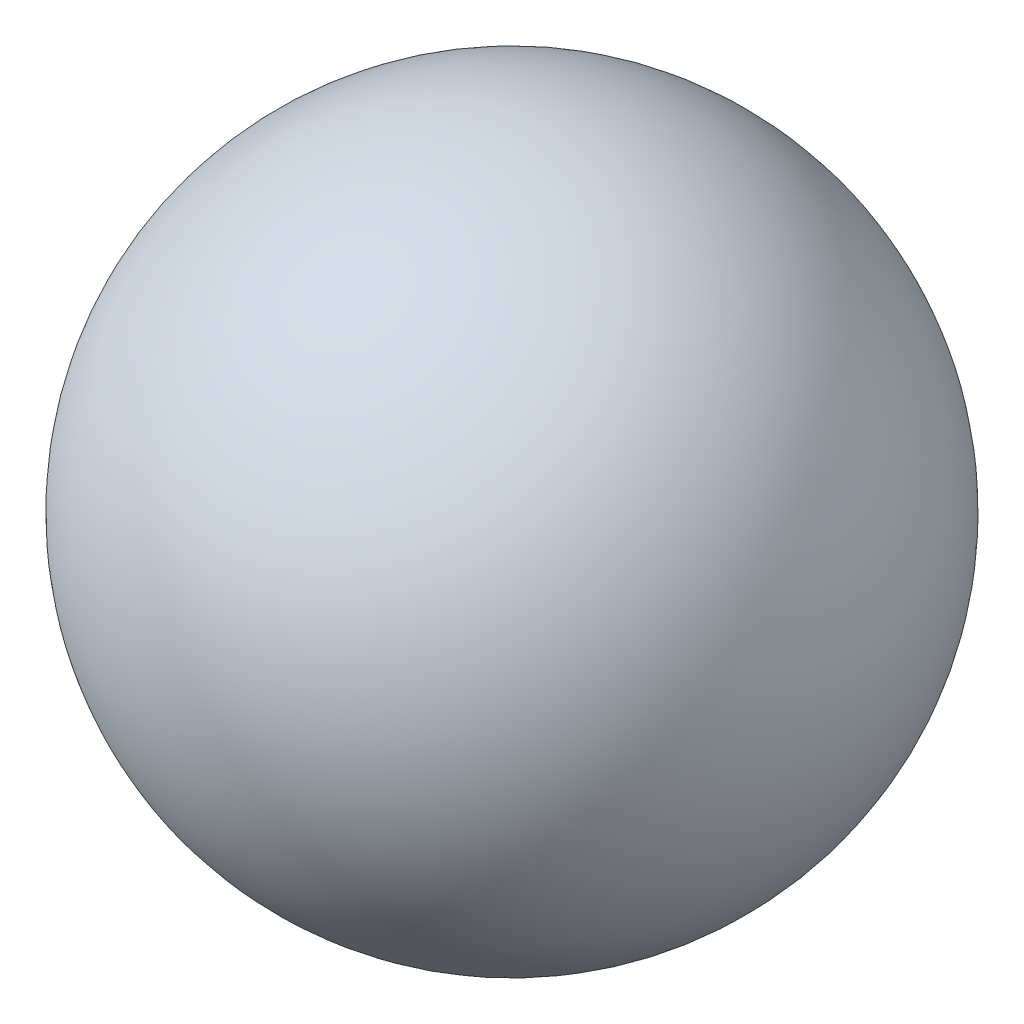
from build123d import *


with BuildPart() as part:
    # Sketch2 → Revolve1 (revolve)
    with BuildSketch(Plane(origin=(0, 0, 0), x_dir=(1, 0, 0), z_dir=(0, 1, 0))):
        with BuildLine():
            Line((0, 6), (0, -6))
            ThreePointArc((0, -6), (-6, 0), (0, 6))
        make_face()
    revolve(axis=Axis((0, 0, -6), (0, 0, 1)))


solid = part.part
